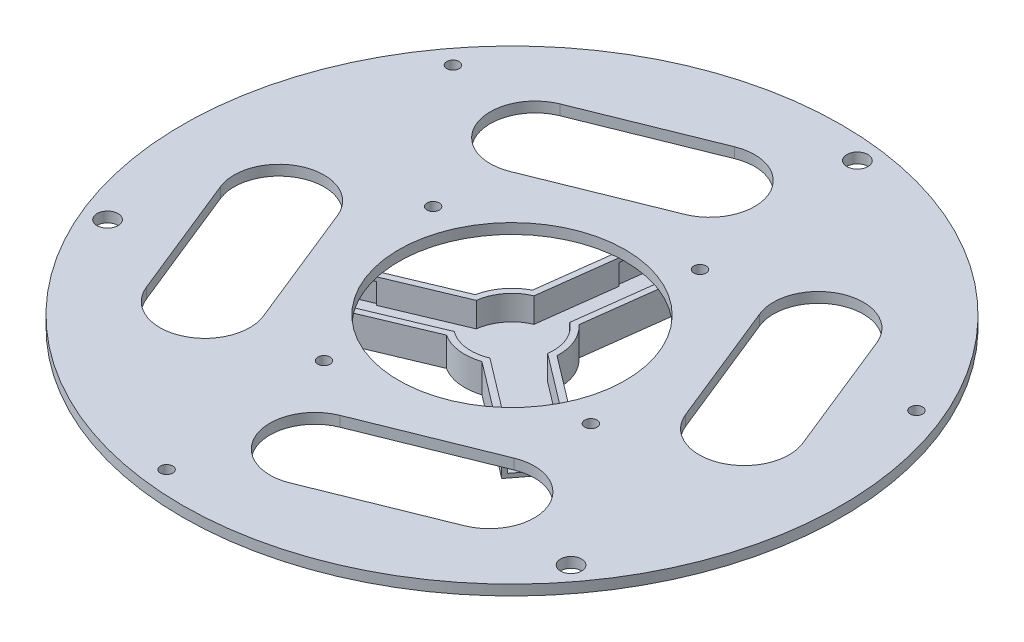
from build123d import *

# Parameters (mm, degrees)
SKETCH1_R           = 160
SKETCH1_R_2         = 55
BOSS_EXTRUDE1_DEPTH = 3
SKETCH2_R           = 2.5
CUT_EXTRUDE1_DEPTH  = 5
CIRPATTERN1_COUNT   = 4
SKETCH3_R           = 5.1
CUT_EXTRUDE3_DEPTH  = 227.294056484
CIRPATTERN2_COUNT   = 3
CUT_EXTRUDE4_DEPTH  = 227.294056484
CIRPATTERN3_COUNT   = 4
SKETCH5_R           = 160
BOSS_EXTRUDE2_DEPTH = 5
SKETCH6_R           = 5.1
CUT_EXTRUDE5_DEPTH  = 5
SKETCH7_R           = 5.1
CUT_EXTRUDE6_DEPTH  = 5
SKETCH8_R           = 5.1
CUT_EXTRUDE7_DEPTH  = 5
CUT_EXTRUDE8_START  = -5
SKETCH9_R           = 2.5
CUT_EXTRUDE8_DEPTH  = 5
CUT_EXTRUDE9_START  = -5
SKETCH10_R          = 2.5
CUT_EXTRUDE9_DEPTH  = 5
CUT_EXTRUDE10_START = -5
SKETCH11_R          = 2.5
CUT_EXTRUDE10_DEPTH = 5
CUT_EXTRUDE11_START = -5
SKETCH12_R          = 2.5
CUT_EXTRUDE11_DEPTH = 5
SKETCH13_R          = 55
CUT_EXTRUDE12_DEPTH = 5
CUT_EXTRUDE15_DEPTH = 5
SKETCH15_R          = 160
CUT_EXTRUDE16_DEPTH = 3
BOSS_EXTRUDE4_DEPTH = 14
SKETCH20_R          = 18
CUT_EXTRUDE19_DEPTH = 13
CUT_EXTRUDE21_DEPTH = 14
CUT_EXTRUDE24_START = -14
CUT_EXTRUDE24_DEPTH = 14
CUT_EXTRUDE22_START = -5
SKETCH23_R          = 5.1
CUT_EXTRUDE22_DEPTH = 5
SKETCH24_R          = 3
CUT_EXTRUDE23_DEPTH = 10
BOSS_EXTRUDE6_START = -5
SKETCH25_R          = 5.1
SKETCH25_R_2        = 3
BOSS_EXTRUDE6_DEPTH = 5
BOSS_EXTRUDE7_DEPTH = 12
BOSS_EXTRUDE8_DEPTH = 2
SKETCH28_W          = 22
SKETCH28_H          = 10
CUT_EXTRUDE25_DEPTH = 15
SKETCH29_W          = 22
SKETCH29_H          = 10
CUT_EXTRUDE26_DEPTH = 15
SKETCH30_W          = 22
SKETCH30_H          = 10
CUT_EXTRUDE27_DEPTH = 15


# Read off the part's stored shape, not the designer's step: Cut-Extrude24
with BuildPart() as part:
    # Sketch1 → Boss-Extrude1 (new body)
    with BuildSketch(Plane(origin=(0, 0, 0), x_dir=(1, 0, 0), z_dir=(0, 1, 0))):
        with Locations(Location((0, 0, 0), (0, 0, 270))):
            Circle(SKETCH1_R)
        with Locations(Location((0, 0, 0), (0, 0, 270))):
            Circle(SKETCH1_R_2, mode=Mode.SUBTRACT)
    extrude(amount=BOSS_EXTRUDE1_DEPTH)

    # Sketch2 → Cut-Extrude1 (cut)
    with BuildSketch(Plane(origin=(0, 3, 0), x_dir=(1, 0, 0), z_dir=(0, 1, 0))):
        with Locations(Location((64.794876894, -26.488184691, 0), (0, 0, 270))):
            Circle(SKETCH2_R)
    cut_extrude1 = extrude(amount=-CUT_EXTRUDE1_DEPTH, mode=Mode.SUBTRACT)

    # CirPattern1: Cut-Extrude1 ×4 about axis
    cirpattern1_axis = Axis((0, 0, 0), (0, 1, 0))
    for i in range(1, CIRPATTERN1_COUNT):
        add(cut_extrude1.rotate(cirpattern1_axis, i * 360 / CIRPATTERN1_COUNT), mode=Mode.SUBTRACT)

    # Sketch3 → Cut-Extrude3 (cut, through all)
    with BuildSketch(Plane.XZ):
        with Locations(Location((138.31376779, -58.045685797, 0), (0, 0, 270))):
            Circle(SKETCH3_R)
    cut_extrude3 = extrude(amount=-CUT_EXTRUDE3_DEPTH, mode=Mode.SUBTRACT)

    # CirPattern2: Cut-Extrude3 ×3 about axis
    cirpattern2_axis = Axis((0, 0, 0), (0, 1, 0))
    for i in range(1, CIRPATTERN2_COUNT):
        add(cut_extrude3.rotate(cirpattern2_axis, i * 360 / CIRPATTERN2_COUNT), mode=Mode.SUBTRACT)

    # Sketch4 → Cut-Extrude4 (cut, through all)
    with BuildSketch(Plane(origin=(0, 3, 0), x_dir=(1, 0, 0), z_dir=(0, 1, 0))):
        with BuildLine():
            Line((87.478831685, -99.495507551), (8.645776426, -131.281501299))
            ThreePointArc((8.645776426, -131.281501299), (-23.889237988, -117.444130267), (-10.051866955, -84.909115853))
            Line((-10.051866955, -84.909115853), (68.781188304, -53.123122105))
            ThreePointArc((68.781188304, -53.123122105), (101.316202717, -66.960493137), (87.478831685, -99.495507551))
        make_face()
    cut_extrude4 = extrude(amount=-CUT_EXTRUDE4_DEPTH, mode=Mode.SUBTRACT)

    # CirPattern3: Cut-Extrude4 ×4 about axis
    cirpattern3_axis = Axis((0, 0, 0), (0, 1, 0))
    for i in range(1, CIRPATTERN3_COUNT):
        add(cut_extrude4.rotate(cirpattern3_axis, i * 360 / CIRPATTERN3_COUNT), mode=Mode.SUBTRACT)

    # Sketch5 → Boss-Extrude2 (add)
    with BuildSketch(Plane(origin=(0, 3, 0), x_dir=(1, 0, 0), z_dir=(0, 1, 0))):
        with Locations(Location((0, 0, 0), (0, 0, 270))):
            Circle(SKETCH5_R)
    extrude(amount=BOSS_EXTRUDE2_DEPTH)

    # Sketch6 → Cut-Extrude5 (cut)
    with BuildSketch(Plane(origin=(0, 3, 0), x_dir=(-1, 0, 0), z_dir=(0, -1, 0))):
        with Locations(Location((-138.31376779, 58.045685797, 0), (0, 0, 90))):
            Circle(SKETCH6_R)
    extrude(amount=-CUT_EXTRUDE5_DEPTH, mode=Mode.SUBTRACT)

    # Sketch7 → Cut-Extrude6 (cut)
    with BuildSketch(Plane(origin=(0, 3, 0), x_dir=(-1, 0, 0), z_dir=(0, -1, 0))):
        with Locations(Location((119.425922375, 90.760393701, 0), (0, 0, 330))):
            Circle(SKETCH7_R)
    extrude(amount=-CUT_EXTRUDE6_DEPTH, mode=Mode.SUBTRACT)

    # Sketch8 → Cut-Extrude7 (cut)
    with BuildSketch(Plane(origin=(0, 3, 0), x_dir=(-1, 0, 0), z_dir=(0, -1, 0))):
        with Locations(Location((18.887845415, -148.806079498, 0), (0, 0, 210))):
            Circle(SKETCH8_R)
    extrude(amount=-CUT_EXTRUDE7_DEPTH, mode=Mode.SUBTRACT)

    # Sketch9 → Cut-Extrude8 (cut)
    with BuildSketch(Plane(origin=(0, 3, 0), x_dir=(-1, 0, 0), z_dir=(0, -1, 0)).offset(CUT_EXTRUDE8_START)):
        with Locations(Location((26.488184691, -64.794876894, 0), (0, 0, 270))):
            Circle(SKETCH9_R)
    extrude(amount=CUT_EXTRUDE8_DEPTH, mode=Mode.SUBTRACT)

    # Sketch10 → Cut-Extrude9 (cut)
    with BuildSketch(Plane(origin=(0, 3, 0), x_dir=(-1, 0, 0), z_dir=(0, -1, 0)).offset(CUT_EXTRUDE9_START)):
        with Locations(Location((-64.794876894, -26.488184691, 0), (0, 0, 270))):
            Circle(SKETCH10_R)
    extrude(amount=CUT_EXTRUDE9_DEPTH, mode=Mode.SUBTRACT)

    # Sketch11 → Cut-Extrude10 (cut)
    with BuildSketch(Plane(origin=(0, 3, 0), x_dir=(-1, 0, 0), z_dir=(0, -1, 0)).offset(CUT_EXTRUDE10_START)):
        with Locations(Location((64.794876894, 26.488184691, 0), (0, 0, 270))):
            Circle(SKETCH11_R)
    extrude(amount=CUT_EXTRUDE10_DEPTH, mode=Mode.SUBTRACT)

    # Sketch12 → Cut-Extrude11 (cut)
    with BuildSketch(Plane(origin=(0, 3, 0), x_dir=(-1, 0, 0), z_dir=(0, -1, 0)).offset(CUT_EXTRUDE11_START)):
        with Locations(Location((-26.488184691, 64.794876894, 0), (0, 0, 270))):
            Circle(SKETCH12_R)
    extrude(amount=CUT_EXTRUDE11_DEPTH, mode=Mode.SUBTRACT)

    # Sketch13 → Cut-Extrude12 (cut)
    with BuildSketch(Plane(origin=(0, 3, 0), x_dir=(-1, 0, 0), z_dir=(0, -1, 0))):
        with Locations(Location((0, 0, 0), (0, 0, 90))):
            Circle(SKETCH13_R)
    extrude(amount=-CUT_EXTRUDE12_DEPTH, mode=Mode.SUBTRACT)

    # Sketch14 → Cut-Extrude15 (cut)
    with BuildSketch(Plane(origin=(0, 3, 0), x_dir=(-1, 0, 0), z_dir=(0, -1, 0))):
        with BuildLine():
            ThreePointArc((-60.628569817, -59.644993908), (-89.089834339, -71.652332254), (-77.082495993, -100.113596776))
            Line((-77.082495993, -100.113596776), (-76.964890019, -100.161016259))
            Line((-76.964890019, -100.161016259), (-46.822839479, -112.314484457))
            Line((-46.822839479, -112.314484457), (-16.680788939, -124.467952655))
            ThreePointArc((-16.680788939, -124.467952655), (11.745382338, -112.37810158), (-0.344468737, -83.951930304))
            Line((-0.344468737, -83.951930304), (-30.486519277, -71.798462106))
            Line((-30.486519277, -71.798462106), (-60.628569817, -59.644993908))
        make_face()
        with BuildLine():
            ThreePointArc((124.759629496, -16.798394913), (112.75229115, 11.662869609), (84.291026628, -0.344468737))
            Line((84.291026628, -0.344468737), (84.243607145, -0.462074711))
            Line((84.243607145, -0.462074711), (59.936670749, -60.746175791))
            ThreePointArc((59.936670749, -60.746175791), (72.026521824, -89.172347068), (100.4526931, -77.082495993))
            Line((100.4526931, -77.082495993), (112.606161298, -46.940445453))
            Line((112.606161298, -46.940445453), (124.759629496, -16.798394913))
        make_face()
        with BuildLine():
            Line((-71.798462106, 30.486519277), (-59.644993908, 60.628569817))
            ThreePointArc((-59.644993908, 60.628569817), (-71.652332254, 89.089834339), (-100.113596776, 77.082495993))
            Line((-100.113596776, 77.082495993), (-100.161016259, 76.964890019))
            Line((-100.161016259, 76.964890019), (-112.314484457, 46.822839479))
            Line((-112.314484457, 46.822839479), (-124.467952655, 16.680788939))
            ThreePointArc((-124.467952655, 16.680788939), (-112.37810158, -11.745382338), (-83.951930304, 0.344468737))
            Line((-83.951930304, 0.344468737), (-71.798462106, 30.486519277))
        make_face()
        with BuildLine():
            Line((46.940445453, 112.606161298), (16.798394913, 124.759629496))
            ThreePointArc((16.798394913, 124.759629496), (-11.662869609, 112.75229115), (0.344468737, 84.291026628))
            Line((0.344468737, 84.291026628), (0.462074711, 84.243607145))
            Line((0.462074711, 84.243607145), (60.746175791, 59.936670749))
            ThreePointArc((60.746175791, 59.936670749), (89.172347068, 72.026521824), (77.082495993, 100.4526931))
            Line((77.082495993, 100.4526931), (46.940445453, 112.606161298))
        make_face()
    extrude(amount=-CUT_EXTRUDE15_DEPTH, mode=Mode.SUBTRACT)

    # Sketch15 → Cut-Extrude16 (cut)
    with BuildSketch(Plane.XZ):
        with Locations(Location((0, 0, 0), (0, 0, 270))):
            Circle(SKETCH15_R)
    extrude(amount=-CUT_EXTRUDE16_DEPTH, mode=Mode.SUBTRACT)

    # Sketch16 → Boss-Extrude4 (add)
    with BuildSketch(Plane(origin=(0, 3, 0), x_dir=(-1, 0, 0), z_dir=(0, -1, 0))):
        with BuildLine():
            Line((-65.945399863, 16.830182544), (-58.20597509, 35.272018249))
            Line((-58.20597509, 35.272018249), (-12.101385827, 15.923456317))
            ThreePointArc((-12.101385827, 15.923456317), (-2.518379389, 19.8408106), (7.739424773, 18.441835705))
            Line((7.739424773, 18.441835705), (47.548065565, 48.695300272))
            Line((47.548065565, 48.695300272), (59.649451391, 32.771843956))
            Line((59.649451391, 32.771843956), (19.8408106, 2.518379389))
            ThreePointArc((19.8408106, 2.518379389), (18.441835705, -7.739424773), (12.101385827, -15.923456317))
            Line((12.101385827, -15.923456317), (18.397334299, -65.525482816))
            Line((18.397334299, -65.525482816), (-1.443476301, -68.043862205))
            Line((-1.443476301, -68.043862205), (-7.739424773, -18.441835705))
            ThreePointArc((-7.739424773, -18.441835705), (-15.923456317, -12.101385827), (-19.8408106, -2.518379389))
            Line((-19.8408106, -2.518379389), (-65.945399863, 16.830182544))
        make_face()
    extrude(amount=BOSS_EXTRUDE4_DEPTH)

    # Sketch20 → Cut-Extrude19 (cut)
    with BuildSketch(Plane(origin=(0, 3, 0), x_dir=(1, 0, 0), z_dir=(0, 1, 0))):
        with Locations(Location((0, 0, 0), (0, 0, 270))):
            Circle(SKETCH20_R)
    extrude(amount=-CUT_EXTRUDE19_DEPTH, mode=Mode.SUBTRACT)

    # Sketch21 → Cut-Extrude21 (cut)
    with BuildSketch(Plane.XZ.offset(11)):
        Polygon((-48.153134856, -47.899127457), (-59.0443821, -33.568016772), (-9.582658928, 4.021523078), (-17.405293769, 65.651401785), (0.451435771, 67.917943235), (8.274070612, 6.288064528), (65.558428625, -17.752274329), (58.592946329, -34.349926464), (1.308588316, -10.309587607), align=None)
    extrude(amount=-CUT_EXTRUDE21_DEPTH, mode=Mode.SUBTRACT)

    # Cut-Extrude24 outline → Cut-Extrude24 (cut)
    with BuildSketch(Plane(origin=(0, -11, 0), x_dir=(-1, 0, 0), z_dir=(0, -1, 0)).offset(CUT_EXTRUDE24_START)):
        with BuildLine():
            Line((17.405293769, -65.651401785), (18.397334299, -65.525482816))
            Line((18.397334299, -65.525482816), (12.101385827, -15.923456317))
            ThreePointArc((12.101385827, -15.923456317), (18.441835705, -7.739424773), (19.8408106, 2.518379389))
            Line((19.8408106, 2.518379389), (59.649451391, 32.771843956))
            Line((59.649451391, 32.771843956), (59.0443821, 33.568016772))
            Line((59.0443821, 33.568016772), (9.582658928, -4.021523078))
            Line((9.582658928, -4.021523078), (17.405293769, -65.651401785))
        make_face()
        with BuildLine():
            Line((-1.443476301, -68.043862205), (-0.451435771, -67.917943235))
            Line((-0.451435771, -67.917943235), (-8.274070612, -6.288064528))
            Line((-8.274070612, -6.288064528), (-65.558428625, 17.752274329))
            Line((-65.558428625, 17.752274329), (-65.945399863, 16.830182544))
            Line((-65.945399863, 16.830182544), (-19.8408106, -2.518379389))
            ThreePointArc((-19.8408106, -2.518379389), (-15.923456317, -12.101385827), (-7.739424773, -18.441835705))
            Line((-7.739424773, -18.441835705), (-1.443476301, -68.043862205))
        make_face()
        with BuildLine():
            Line((48.153134856, 47.899127457), (47.548065565, 48.695300272))
            Line((47.548065565, 48.695300272), (7.739424773, 18.441835705))
            ThreePointArc((7.739424773, 18.441835705), (-2.518379389, 19.8408106), (-12.101385827, 15.923456317))
            Line((-12.101385827, 15.923456317), (-58.20597509, 35.272018249))
            Line((-58.20597509, 35.272018249), (-58.592946329, 34.349926464))
            Line((-58.592946329, 34.349926464), (-1.308588316, 10.309587607))
            Line((-1.308588316, 10.309587607), (48.153134856, 47.899127457))
        make_face()
    extrude(amount=CUT_EXTRUDE24_DEPTH, mode=Mode.SUBTRACT)

    # Sketch23 → Cut-Extrude22 (cut)
    with BuildSketch(Plane(origin=(0, 8, 0), x_dir=(1, 0, 0), z_dir=(0, 1, 0)).offset(CUT_EXTRUDE22_START)):
        with Locations(Location((-119.425922375, 90.760393701, 0), (0, 0, 90))):
            Circle(SKETCH23_R)
        with Locations(Location((138.31376779, 58.045685797, 0), (0, 0, 90))):
            Circle(SKETCH23_R)
        with Locations(Location((-18.887845415, -148.806079498, 0), (0, 0, 90))):
            Circle(SKETCH23_R)
        with Locations(Location((-138.31376779, -58.045685797, 0), (0, 0, 270))):
            Circle(SKETCH23_R)
        with Locations(Location((18.887845415, 148.806079498, 0), (0, 0, 270))):
            Circle(SKETCH23_R)
        with Locations(Location((119.425922375, -90.760393701, 0), (0, 0, 270))):
            Circle(SKETCH23_R)
    extrude(amount=CUT_EXTRUDE22_DEPTH, mode=Mode.SUBTRACT)

    # Sketch24 → Cut-Extrude23 (cut)
    with BuildSketch(Plane(origin=(0, 8, 0), x_dir=(1, 0, 0), z_dir=(0, 1, 0))):
        with Locations(Location((64.794876894, -26.488184691, 0), (0, 0, 270))):
            Circle(SKETCH24_R)
        with Locations(Location((-26.488184691, -64.794876894, 0), (0, 0, 270))):
            Circle(SKETCH24_R)
        with Locations(Location((-64.794876894, 26.488184691, 0), (0, 0, 270))):
            Circle(SKETCH24_R)
        with Locations(Location((26.488184691, 64.794876894, 0), (0, 0, 270))):
            Circle(SKETCH24_R)
    extrude(amount=-CUT_EXTRUDE23_DEPTH, mode=Mode.SUBTRACT)

    # Sketch25 → Boss-Extrude6 (add)
    # profile 1 of 3: a face of its own
    with BuildSketch(Plane(origin=(0, 8, 0), x_dir=(1, 0, 0), z_dir=(0, 1, 0)).offset(BOSS_EXTRUDE6_START)):
        with Locations((-119.425922375, 90.760393701)):
            Circle(SKETCH25_R)
        with Locations(Location((-119.425922375, 90.760393701, 0), (0, 0, 270))):
            Circle(SKETCH25_R_2, mode=Mode.SUBTRACT)
    # profile 2 of 3: a face of its own
    with BuildSketch(Plane(origin=(0, 8, 0), x_dir=(1, 0, 0), z_dir=(0, 1, 0)).offset(BOSS_EXTRUDE6_START)):
        with Locations((138.31376779, 58.045685797)):
            Circle(SKETCH25_R)
        with Locations(Location((138.31376779, 58.045685797, 0), (0, 0, 270))):
            Circle(SKETCH25_R_2, mode=Mode.SUBTRACT)
    # profile 3 of 3: a face of its own
    with BuildSketch(Plane(origin=(0, 8, 0), x_dir=(1, 0, 0), z_dir=(0, 1, 0)).offset(BOSS_EXTRUDE6_START)):
        with Locations((-18.887845415, -148.806079498)):
            Circle(SKETCH25_R)
        with Locations(Location((-18.887845415, -148.806079498, 0), (0, 0, 270))):
            Circle(SKETCH25_R_2, mode=Mode.SUBTRACT)
    extrude(amount=BOSS_EXTRUDE6_DEPTH)

    # Sketch26 → Boss-Extrude7 (add)
    with BuildSketch(Plane(origin=(0, 3, 0), x_dir=(-1, 0, 0), z_dir=(0, -1, 0))):
        with BuildLine():
            Line((4.176697652, 70.335285359), (-21.616356127, 67.061392154))
            Line((-21.616356127, 67.061392154), (-15.285671354, 17.185699033))
            ThreePointArc((-15.285671354, 17.185699033), (-21.208111061, 8.900338489), (-22.972217842, -1.130136011))
            Line((-22.972217842, -1.130136011), (-63.000492729, -31.550516409))
            Line((-63.000492729, -31.550516409), (-47.268691155, -52.25100962))
            Line((-47.268691155, -52.25100962), (-7.240416267, -21.830629223))
            ThreePointArc((-7.240416267, -21.830629223), (2.896136297, -22.81693219), (12.464835417, -19.329456227))
            Line((12.464835417, -19.329456227), (58.823795077, -38.78476895))
            Line((58.823795077, -38.78476895), (68.885047282, -14.810382533))
            Line((68.885047282, -14.810382533), (22.526087621, 4.64493019))
            ThreePointArc((22.526087621, 4.64493019), (18.311974764, 13.916593701), (10.507382426, 20.459592238))
            Line((10.507382426, 20.459592238), (4.176697652, 70.335285359))
        make_face()
        with BuildLine():
            Line((64.95785821, -16.415744173), (57.218433437, -34.857579879))
            Line((57.218433437, -34.857579879), (12.101385827, -15.923456317))
            ThreePointArc((12.101385827, -15.923456317), (2.518379389, -19.8408106), (-7.739424773, -18.441835705))
            Line((-7.739424773, -18.441835705), (-46.695380581, -48.047283299))
            Line((-46.695380581, -48.047283299), (-58.796766408, -32.123826982))
            Line((-58.796766408, -32.123826982), (-19.8408106, -2.518379389))
            ThreePointArc((-19.8408106, -2.518379389), (-18.441835705, 7.739424773), (-12.101385827, 15.923456317))
            Line((-12.101385827, 15.923456317), (-18.262477629, 64.463027472))
            Line((-18.262477629, 64.463027472), (1.578332971, 66.981406861))
            Line((1.578332971, 66.981406861), (7.739424773, 18.441835705))
            ThreePointArc((7.739424773, 18.441835705), (15.923456317, 12.101385827), (19.8408106, 2.518379389))
            Line((19.8408106, 2.518379389), (64.95785821, -16.415744173))
        make_face(mode=Mode.SUBTRACT)
    extrude(amount=BOSS_EXTRUDE7_DEPTH)

    # Sketch27 → Boss-Extrude8 (add)
    with BuildSketch(Plane.XZ.offset(9)):
        with BuildLine():
            Line((-4.176697652, -70.335285359), (21.616356127, -67.061392154))
            Line((21.616356127, -67.061392154), (15.285671354, -17.185699033))
            ThreePointArc((15.285671354, -17.185699033), (21.208111061, -8.900338489), (22.972217842, 1.130136011))
            Line((22.972217842, 1.130136011), (63.000492729, 31.550516409))
            Line((63.000492729, 31.550516409), (47.268691155, 52.25100962))
            Line((47.268691155, 52.25100962), (7.240416267, 21.830629223))
            ThreePointArc((7.240416267, 21.830629223), (-2.896136297, 22.81693219), (-12.464835417, 19.329456227))
            Line((-12.464835417, 19.329456227), (-58.823795077, 38.78476895))
            Line((-58.823795077, 38.78476895), (-68.885047282, 14.810382533))
            Line((-68.885047282, 14.810382533), (-22.526087621, -4.64493019))
            ThreePointArc((-22.526087621, -4.64493019), (-18.311974764, -13.916593701), (-10.507382426, -20.459592238))
            Line((-10.507382426, -20.459592238), (-4.176697652, -70.335285359))
        make_face()
    extrude(amount=BOSS_EXTRUDE8_DEPTH)

    # Sketch28 → Cut-Extrude25 (cut)
    with BuildSketch(Plane(origin=(8.719829237, 0, -68.698338756), x_dir=(-0.9920405299868311, 0, -0.12591896943450326), z_dir=(0.12591896943450323, 0, -0.992040529986831))):
        with Locations((0, -4)):
            Rectangle(SKETCH28_W, SKETCH28_H)
    extrude(amount=-CUT_EXTRUDE25_DEPTH, mode=Mode.SUBTRACT)

    # Sketch29 → Cut-Extrude26 (cut)
    with BuildSketch(Plane(origin=(-63.854421179, 0, 26.797575742), x_dir=(0.38697123864478344, 0, 0.9220917852696239), z_dir=(-0.9220917852696239, 0, 0.38697123864478344))):
        with Locations((0, -4)):
            Rectangle(SKETCH29_W, SKETCH29_H)
    extrude(amount=-CUT_EXTRUDE26_DEPTH, mode=Mode.SUBTRACT)

    # Sketch30 → Cut-Extrude27 (cut)
    with BuildSketch(Plane(origin=(55.134591942, 0, 41.900763014), x_dir=(0.6050692913420499, 0, -0.7961728158351237), z_dir=(0.7961728158351237, 0, 0.6050692913420498))):
        with Locations((0, -4)):
            Rectangle(SKETCH30_W, SKETCH30_H)
    extrude(amount=-CUT_EXTRUDE27_DEPTH, mode=Mode.SUBTRACT)


solid = part.part
